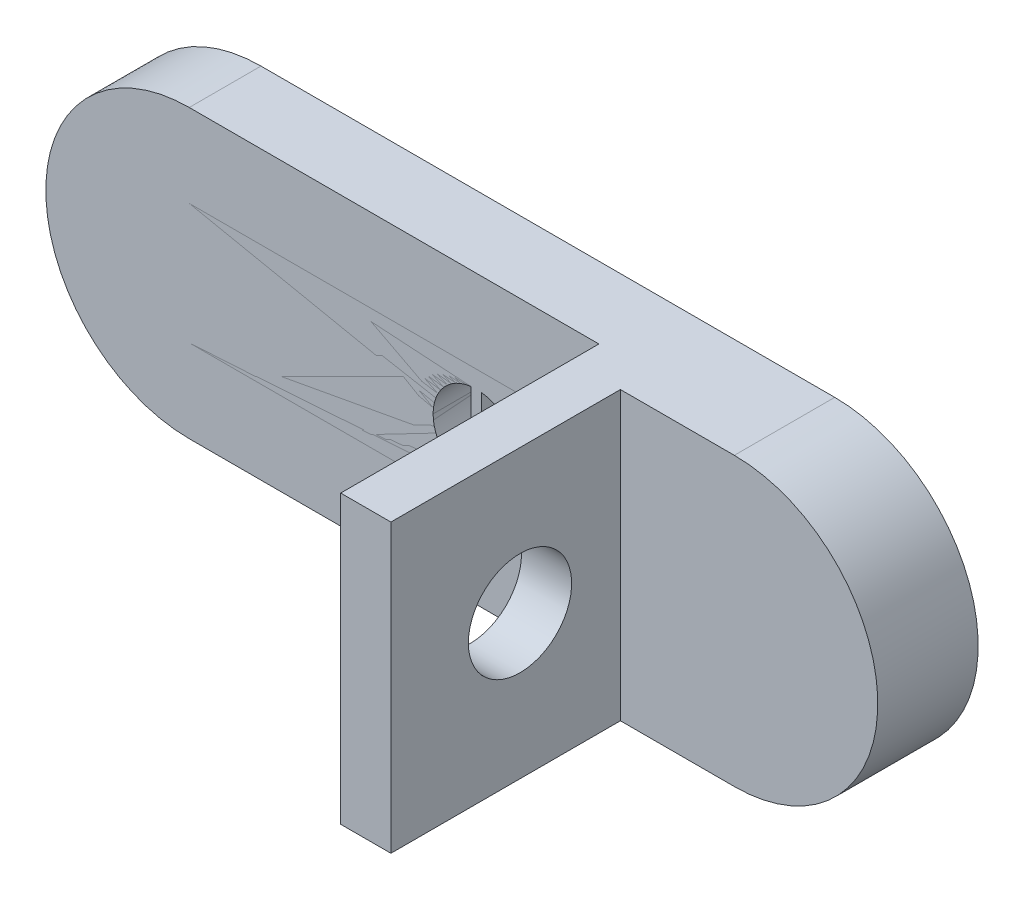
from build123d import *

# Parameters (mm, degrees)
EXTRUDE_1_DEPTH       = 5
SKETCH_1_3_W          = 0.75
SKETCH_1_3_H          = 6
EXTRUDE_2_DEPTH       = 5
EXTRUDE_10_DEPTH      = 5
EXTRUDE_16_DEPTH      = 5
EXTRUDE_18_DEPTH      = 18
EXTRUDE_18_DEPTH_BACK = 5
SKETCH_2_W            = 3.5
SKETCH_2_H            = 20
SKETCH_3_R            = 3.6
CUT_EXTRUDE_2_DEPTH   = 3.5
SKETCH_4_R            = 10
SKETCH_4_W            = 7.941870484
SKETCH_4_H            = 20
EXTRUDE_21_DEPTH      = 2
SKETCH_1_20_W         = 0.75
SKETCH_1_20_H         = 6
EXTRUDE_23_DEPTH      = 5


# Read off the part's stored shape, not the designer's step: 凸台-拉伸10
with BuildPart() as part:
    # 草图1 → 凸台-拉伸1 (new body)
    with BuildSketch(Plane.XY):
        with BuildLine():
            Line((-20, -4.209395136), (20, -4.209395136))
            ThreePointArc((20, -4.209395136), (24.209395136, 0), (20, 4.209395136))
            Line((20, 4.209395136), (-20, 4.209395136))
            ThreePointArc((-20, 4.209395136), (-24.209395136, 0), (-20, -4.209395136))
        make_face()
        with BuildLine():
            Line((6e-09, -3), (-0.375, -3))
            Line((-0.375, -3), (-0.375, -2.976470225))
            ThreePointArc((-0.375, -2.976470225), (-3, 0), (-0.375, 2.976470225))
            Line((-0.375, 2.976470225), (-0.375, 3))
            Line((-0.375, 3), (0, 3))
            Line((0, 3), (0.375, 3))
            Line((0.375, 3), (0.375, 2.976470225))
            ThreePointArc((0.375, 2.976470225), (2.25, 1.984313483), (3, 0))
            ThreePointArc((3, 0), (2.25, -1.984313483), (0.375, -2.976470225))
            Line((0.375, -2.976470225), (0.375, -3))
            Line((0.375, -3), (6e-09, -3))
        make_face(mode=Mode.SUBTRACT)
    extrude(amount=EXTRUDE_1_DEPTH)

    # 草图1<3> → 凸台-拉伸2 (add)
    with BuildSketch(Plane.XY):
        Rectangle(SKETCH_1_3_W, SKETCH_1_3_H)
    extrude(amount=EXTRUDE_2_DEPTH)


with BuildPart() as body_2:
    # 凸台-拉伸10 outline → 凸台-拉伸10 (new body)
    with BuildSketch(Plane.XY):
        with BuildLine():
            Line((20, 4.209395136), (-20, 4.209395136))
            ThreePointArc((-20, 4.209395136), (-24.209395136, 0), (-20, -4.209395136))
            Line((-20, -4.209395136), (20, -4.209395136))
            ThreePointArc((20, -4.209395136), (24.209395136, 0), (20, 4.209395136))
        make_face()
        with BuildLine():
            Line((-0.375, -3), (-0.375, -2.976470225))
            ThreePointArc((-0.375, -2.976470225), (-3, 0), (-0.375, 2.976470225))
            Line((-0.375, 2.976470225), (-0.375, 3))
            Line((-0.375, 3), (0.375, 3))
            Line((0.375, 3), (0.375, 2.976470225))
            ThreePointArc((0.375, 2.976470225), (3, 0), (0.375, -2.976470225))
            Line((0.375, -2.976470225), (0.375, -3))
            Line((0.375, -3), (-0.375, -3))
        make_face(mode=Mode.SUBTRACT)
    extrude(amount=EXTRUDE_10_DEPTH)

    # 草图1<15> → 凸台-拉伸16 (add)
    with BuildSketch(Plane.XY):
        with BuildLine():
            Line((-20, -10), (20, -10))
            ThreePointArc((20, -10), (30, 0), (20, 10))
            Line((20, 10), (-20, 10))
            ThreePointArc((-20, 10), (-30, 0), (-20, -10))
        make_face()
        with BuildLine():
            ThreePointArc((-20, 4.209395136), (-24.209395136, 0), (-20, -4.209395136))
            Line((-20, -4.209395136), (20, -4.209395136))
            ThreePointArc((20, -4.209395136), (24.209395136, 0), (20, 4.209395136))
            Line((20, 4.209395136), (-20, 4.209395136))
        make_face(mode=Mode.SUBTRACT)
    extrude(amount=EXTRUDE_16_DEPTH)

    # 草图2 → 凸台-拉伸18 (add, two sides: drawn at the far end of the back side and taken through both)
    with BuildSketch(Plane.XY.offset(5).offset(-EXTRUDE_18_DEPTH_BACK)):
        with Locations((10.308129516, 0)):
            Rectangle(SKETCH_2_W, SKETCH_2_H)
    extrude(amount=EXTRUDE_18_DEPTH + EXTRUDE_18_DEPTH_BACK)

    # 草图3 → 切除-拉伸2 (cut)
    with BuildSketch(Plane.ZY.offset(-8.558129516)):
        with Locations((14, 0)):
            Circle(SKETCH_3_R)
    extrude(amount=-CUT_EXTRUDE_2_DEPTH, mode=Mode.SUBTRACT)

    # 草图4 → 凸台-拉伸21 (add)
    with BuildSketch(Plane.XY.offset(5)):
        with Locations((20, 0)):
            Circle(SKETCH_4_R)
        with Locations((16.029064758, 0)):
            Rectangle(SKETCH_4_W, SKETCH_4_H)
    extrude(amount=EXTRUDE_21_DEPTH)

    # 草图1<20> → 凸台-拉伸23 (add)
    with BuildSketch(Plane.XY):
        Rectangle(SKETCH_1_20_W, SKETCH_1_20_H)
    extrude(amount=EXTRUDE_23_DEPTH)


solid = Compound([part.part, body_2.part])
